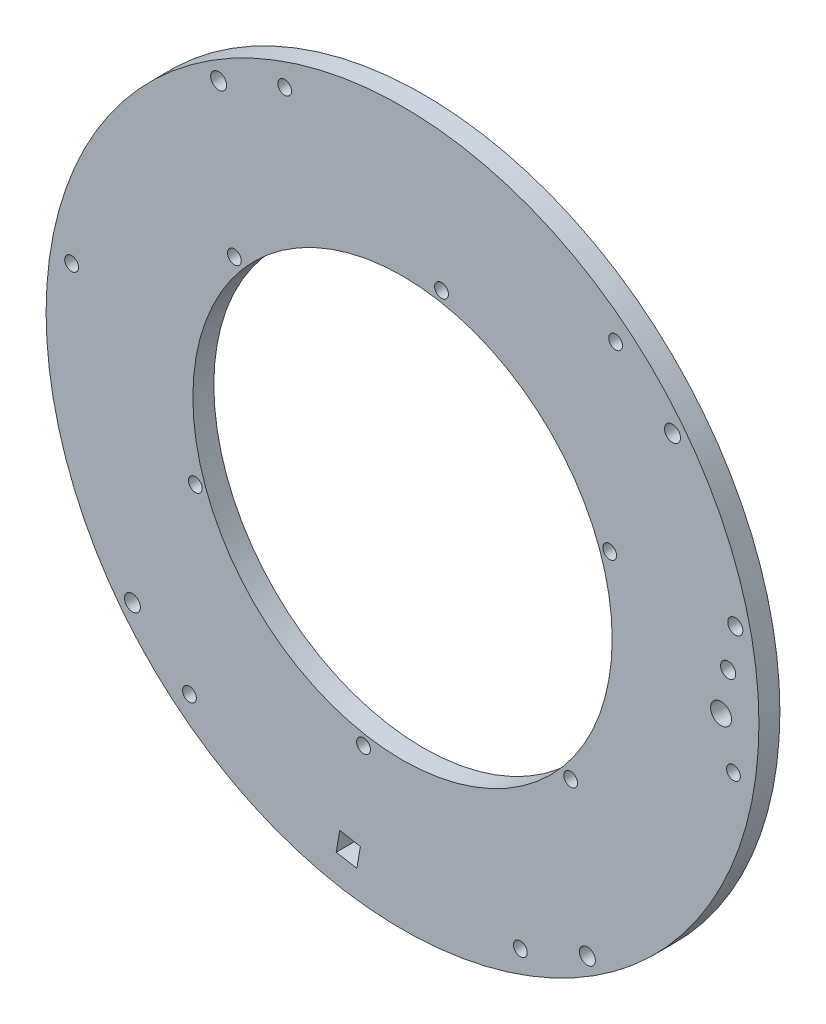
from build123d import *

# Parameters (mm, degrees)
SKETCH1_R                 = 107.95
SKETCH1_R_2               = 63.5
BOSS_EXTRUDE1_DEPTH       = 6.35
SKETCH3_R                 = 2.085
CUT_EXTRUDE2_DEPTH        = 229.663768434
CIRPATTERN1_COUNT         = 6
SKETCH4_R                 = 2.085
CUT_EXTRUDE3_DEPTH        = 229.663768434
CIRPATTERN2_COUNT         = 6
SKETCH5_R                 = 2.413
CUT_EXTRUDE4_DEPTH        = 229.663768434
CUT_EXTRUDE7_DEPTH        = 229.663768434
CUT_EXTRUDE7_DEPTH_BACK   = 229.663768434
SKETCH9_R                 = 2.413
CUT_EXTRUDE8_DEPTH        = 229.663768434
CUT_EXTRUDE10_START       = -6.35
CUT_EXTRUDE10_OUTLINE_R   = 3.175
CUT_EXTRUDE10_OUTLINE_R_2 = 2.286
CUT_EXTRUDE10_DEPTH       = 6.35


# Read off the part's stored shape, not the designer's step: Cut-Extrude10
with BuildPart() as part:
    # Sketch1 → Boss-Extrude1 (new body)
    with BuildSketch(Plane.XY):
        with Locations((51.738381467, 55.593319394)):
            Circle(SKETCH1_R)
        with Locations((51.738381467, 55.593319394)):
            Circle(SKETCH1_R_2, mode=Mode.SUBTRACT)
    extrude(amount=BOSS_EXTRUDE1_DEPTH)

    # Sketch3 → Cut-Extrude2 (cut, through all)
    with BuildSketch(Plane.XY.offset(6.35)):
        with Locations((-12.798570104, -22.876686862)):
            Circle(SKETCH3_R)
    cut_extrude2 = extrude(amount=-CUT_EXTRUDE2_DEPTH, mode=Mode.SUBTRACT)

    # CirPattern1: Cut-Extrude2 ×6 about axis
    cirpattern1_axis = Axis((51.738381467, 55.593319394, 0), (0, 0, 1))
    for i in range(1, CIRPATTERN1_COUNT):
        add(cut_extrude2.rotate(cirpattern1_axis, i * 360 / CIRPATTERN1_COUNT), mode=Mode.SUBTRACT)

    # Sketch4 → Cut-Extrude3 (cut, symmetric)
    with BuildSketch(Plane.XY.offset(6.35)):
        with Locations((39.923069121, -10.026449115)):
            Circle(SKETCH4_R)
    cut_extrude3 = extrude(amount=CUT_EXTRUDE3_DEPTH, both=True, mode=Mode.SUBTRACT)

    # CirPattern2: Cut-Extrude3 ×6 about axis
    cirpattern2_axis = Axis((51.738381467, 55.593319394, 0), (0, 0, 1))
    for i in range(1, CIRPATTERN2_COUNT):
        add(cut_extrude3.rotate(cirpattern2_axis, i * 360 / CIRPATTERN2_COUNT), mode=Mode.SUBTRACT)

    # Sketch5 → Cut-Extrude4 (cut, through all)
    with BuildSketch(Plane.XY.offset(6.35)):
        with Locations((-30.066706461, -7.50922857)):
            Circle(SKETCH5_R)
        with Locations((107.725712792, -31.295181319)):
            Circle(SKETCH5_R)
    extrude(amount=-CUT_EXTRUDE4_DEPTH, mode=Mode.SUBTRACT)

    # Sketch8 → Cut-Extrude7 (cut, two sides: drawn at the far end of the back side and taken through both)
    with BuildSketch(Plane.XY.offset(6.35).offset(-CUT_EXTRUDE7_DEPTH_BACK)):
        Polygon((31.650955464, -42.108620026), (32.73112738, -35.85116618), (38.988581226, -36.931338096), (37.90840931, -43.188791942), align=None)
    extrude(amount=CUT_EXTRUDE7_DEPTH + CUT_EXTRUDE7_DEPTH_BACK, mode=Mode.SUBTRACT)

    # Sketch9 → Cut-Extrude8 (cut, through all)
    with BuildSketch(Plane.XY.offset(6.35)):
        with Locations((-3.948592074, 142.429971857)):
            Circle(SKETCH9_R)
        with Locations((133.51515401, 118.700755207)):
            Circle(SKETCH9_R)
    extrude(amount=-CUT_EXTRUDE8_DEPTH, mode=Mode.SUBTRACT)

    # Cut-Extrude10 outline → Cut-Extrude10 (cut)
    with BuildSketch(Plane(origin=(0, 0, 0), x_dir=(-1, 0, 0), z_dir=(0, 0, -1)).offset(CUT_EXTRUDE10_START)):
        with Locations((-148.210776777, 52.562256335)):
            Circle(CUT_EXTRUDE10_OUTLINE_R)
        with Locations((-152.531464441, 77.592071718)):
            Circle(CUT_EXTRUDE10_OUTLINE_R_2)
        with Locations((-150.371120609, 65.077164026)):
            Circle(CUT_EXTRUDE10_OUTLINE_R_2)
    extrude(amount=CUT_EXTRUDE10_DEPTH, mode=Mode.SUBTRACT)


solid = part.part
